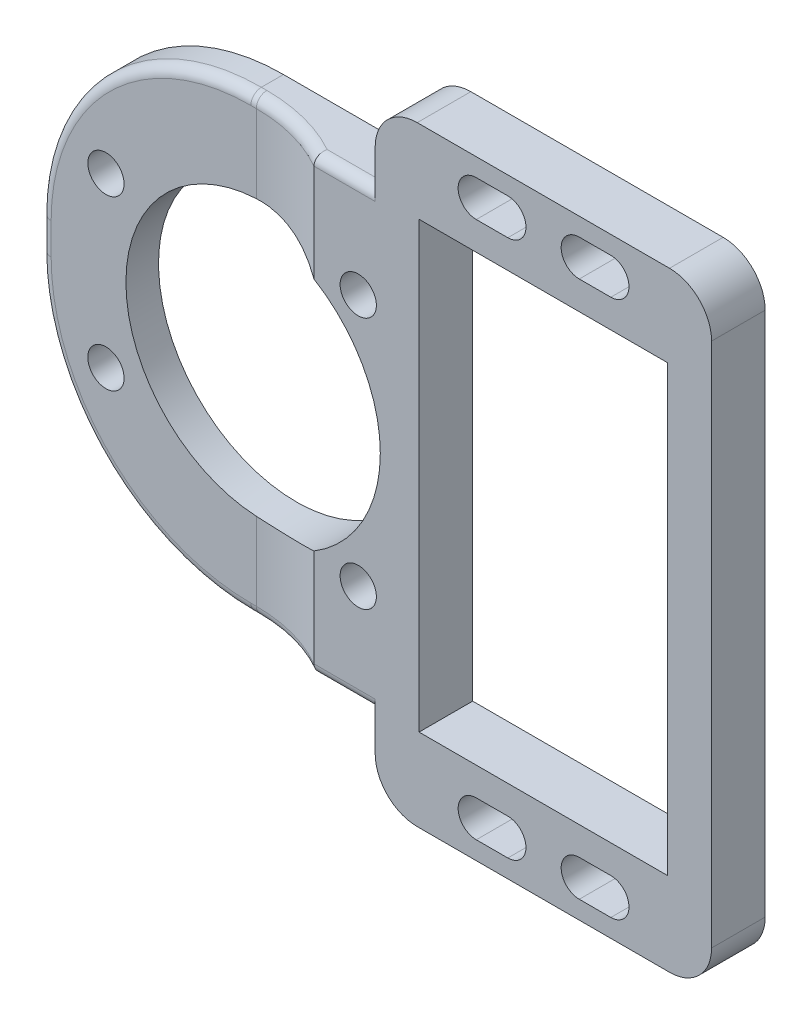
from build123d import *

# Parameters (mm, degrees)
SKETCH1_R           = 1.725
SKETCH1_R_2         = 13.1
SKETCH1_W           = 23.65
SKETCH1_H           = 42.25
BOSS_EXTRUDE1_DEPTH = 5.1
CUT_EXTRUDE1_START  = -2
SKETCH2_R           = 1.725
CUT_EXTRUDE1_DEPTH  = 2
FILLET1_R           = 4
FILLET2_R           = 20
FILLET3_R           = 15
FILLET4_R           = 1


with BuildPart() as part:
    # Sketch1 → Boss-Extrude1 (new body)
    with BuildSketch(Plane.XY):
        Polygon((12.6125, 29), (12.6125, 21.5), (-21.2125, 21.5), (-21.2125, -21.5), (12.6125, -21.5), (12.6125, -29), (44.6125, -29), (44.6125, 29), align=None)
        with Locations((-15, -8)):
            Circle(SKETCH1_R, mode=Mode.SUBTRACT)
        with Locations((-15, 8)):
            Circle(SKETCH1_R, mode=Mode.SUBTRACT)
        with Locations((11, 12)):
            Circle(SKETCH1_R, mode=Mode.SUBTRACT)
        with Locations((11, -12)):
            Circle(SKETCH1_R, mode=Mode.SUBTRACT)
        Circle(SKETCH1_R_2, mode=Mode.SUBTRACT)
        with BuildLine():
            Line((22.229319933, 27.275), (25.229319933, 27.275))
            ThreePointArc((25.229319933, 27.275), (26.954319933, 25.55), (25.229319933, 23.825))
            Line((25.229319933, 23.825), (22.229319933, 23.825))
            ThreePointArc((22.229319933, 23.825), (20.504319933, 25.55), (22.229319933, 27.275))
        make_face(mode=Mode.SUBTRACT)
        with BuildLine():
            Line((32.029319933, 27.275), (35.029319933, 27.275))
            ThreePointArc((35.029319933, 27.275), (36.754319933, 25.55), (35.029319933, 23.825))
            Line((35.029319933, 23.825), (32.029319933, 23.825))
            ThreePointArc((32.029319933, 23.825), (30.304319933, 25.55), (32.029319933, 27.275))
        make_face(mode=Mode.SUBTRACT)
        with BuildLine():
            Line((22.229319933, -23.825), (25.229319933, -23.825))
            ThreePointArc((25.229319933, -23.825), (26.954319933, -25.55), (25.229319933, -27.275))
            Line((25.229319933, -27.275), (22.229319933, -27.275))
            ThreePointArc((22.229319933, -27.275), (20.504319933, -25.55), (22.229319933, -23.825))
        make_face(mode=Mode.SUBTRACT)
        with BuildLine():
            Line((32.029319933, -23.825), (35.029319933, -23.825))
            ThreePointArc((35.029319933, -23.825), (36.754319933, -25.55), (35.029319933, -27.275))
            Line((35.029319933, -27.275), (32.029319933, -27.275))
            ThreePointArc((32.029319933, -27.275), (30.304319933, -25.55), (32.029319933, -23.825))
        make_face(mode=Mode.SUBTRACT)
        with Locations((28.6125, 0)):
            Rectangle(SKETCH1_W, SKETCH1_H, mode=Mode.SUBTRACT)
    extrude(amount=BOSS_EXTRUDE1_DEPTH)

    # Sketch2 → Cut-Extrude1 (cut)
    with BuildSketch(Plane.XY.offset(5.1).offset(CUT_EXTRUDE1_START)):
        with BuildLine():
            Line((6.7875, 11.204456424), (6.7875, 21.5))
            Line((6.7875, 21.5), (-21.2125, 21.5))
            Line((-21.2125, 21.5), (-21.2125, -21.5))
            Line((-21.2125, -21.5), (6.7875, -21.5))
            Line((6.7875, -21.5), (6.7875, -11.204456424))
            ThreePointArc((6.7875, -11.204456424), (-13.1, 0), (6.7875, 11.204456424))
        make_face()
        with Locations((-15, -8)):
            Circle(SKETCH2_R, mode=Mode.SUBTRACT)
        with Locations((-15, 8)):
            Circle(SKETCH2_R, mode=Mode.SUBTRACT)
    extrude(amount=CUT_EXTRUDE1_DEPTH, mode=Mode.SUBTRACT)

    # Fillet1
    fillet1_edges = [part.edges().sort_by_distance(p)[0] for p in [
        (12.6125, 29, 2.55),
        (44.6125, 29, 2.55),
        (44.6125, -29, 2.55),
        (12.6125, -29, 2.55),
    ]]
    fillet(fillet1_edges, radius=FILLET1_R)

    # Fillet2
    fillet2_edges = [part.edges().sort_by_distance(p)[0] for p in [
        (-21.2125, -21.5, 1.55),
        (-21.2125, 21.5, 1.55),
    ]]
    fillet(fillet2_edges, radius=FILLET2_R)

    # Fillet3
    # the kernel refuses this fillet: 15 mm, written as the material it adds along each edge
    with BuildSketch(Plane(origin=(6.7875, -21.5, 3.1), x_dir=(-1, 0, 0), z_dir=(0, 1, 0))) as fillet3_piece_1_section:
        with BuildLine():
            CenterArc((7.483314774, 15), FILLET3_R, 240.073565133, 29.926434867)
            Line((0, 2), (-0.149666295, 1.74))
            ThreePointArc((-0.149666295, 1.74), (-0.3, 1), (-0.3, 0))
            Line((-0.3, 0), (0, -0.3))
            Line((0, -0.3), (7.483314774, -0.3))
            Line((7.483314774, -0.3), (7.483314774, 0))
        make_face()
    fillet3_piece_1 = extrude(amount=29.00383051, mode=Mode.PRIVATE)
    fillet3_piece_1 = fillet3_piece_1 - Plane(origin=(0, 0, 3.507090061), x_dir=(1, 0, 0), z_dir=(0, 0, -1)) * Cylinder(13.1, 88, mode=Mode.PRIVATE)
    add(fillet3_piece_1)
    with BuildSketch(Plane(origin=(6.7875, -7.50383051, 3.1), x_dir=(-1, 0, 0), z_dir=(0, 1, 0))) as fillet3_piece_2_section:
        with BuildLine():
            CenterArc((7.483314774, 15), FILLET3_R, 240.073565133, 29.926434867)
            Line((0, 2), (-0.149666295, 1.74))
            ThreePointArc((-0.149666295, 1.74), (-0.3, 1), (-0.3, 0))
            Line((-0.3, 0), (0, -0.3))
            Line((0, -0.3), (7.483314774, -0.3))
            Line((7.483314774, -0.3), (7.483314774, 0))
        make_face()
    fillet3_piece_2 = extrude(amount=29.00383051, mode=Mode.PRIVATE)
    fillet3_piece_2 = fillet3_piece_2 - Plane(origin=(0, 0, 3.507090028), x_dir=(1, 0, 0), z_dir=(0, 0, -1)) * Cylinder(13.1, 88, mode=Mode.PRIVATE)
    add(fillet3_piece_2)

    # Fillet4
    # the kernel refuses this fillet: 1 mm, written as the material it takes off along each edge
    with BuildSketch(Plane(origin=(4.2875, -21.5, 5.1), x_dir=(0, 1, 0), z_dir=(1, 0, 0)), Plane(origin=(12.6125, 21.5, 5.1), x_dir=(0, -1, 0), z_dir=(-1, 0, 0))) as fillet4_piece_1:
        with BuildLine():
            CenterArc((FILLET4_R, -FILLET4_R), FILLET4_R, 90, 90)
            Line((0, -FILLET4_R), (0, 0))
            Line((0, 0), (FILLET4_R, 0))
        make_face()
    extrude(amount=8.325, mode=Mode.SUBTRACT)
    with BuildSketch(Plane(origin=(-1.2125, -21.5, 3.1), x_dir=(0, 1, 0), z_dir=(1, 0, 0)), Plane(origin=(-0.695814774, 21.5, 3.1), x_dir=(0, -1, 0), z_dir=(-1, 0, 0))) as fillet4_piece_2:
        with BuildLine():
            CenterArc((FILLET4_R, -FILLET4_R), FILLET4_R, 90, 90)
            Line((0, -FILLET4_R), (0, 0))
            Line((0, 0), (FILLET4_R, 0))
        make_face()
    extrude(amount=0.516685226, mode=Mode.SUBTRACT)
    with BuildSketch(Plane(origin=(-21.2125, 1.5, 3.1), x_dir=(1, 0, 0), z_dir=(0, -1, 0))) as fillet4_piece_3:
        with BuildLine():
            CenterArc((FILLET4_R, -FILLET4_R), FILLET4_R, 90, 90)
            Line((0, -FILLET4_R), (0, 0))
            Line((0, 0), (FILLET4_R, 0))
        make_face()
    extrude(amount=3, mode=Mode.SUBTRACT)
    with BuildSketch(Plane(origin=(-1.2125, 1.5, 3.1), x_dir=(0, 1, 0), z_dir=(1, 0, 0))) as fillet4_piece_4:
        with BuildLine():
            CenterArc((20 - FILLET4_R, -FILLET4_R), FILLET4_R, 0, 90)
            Line((20, -FILLET4_R), (20, 0))
            Line((20, 0), (20 - FILLET4_R, 0))
        make_face()
    revolve(axis=Axis((-1.2125, 1.5, 3.1), (0, 0, 1)), revolution_arc=90, mode=Mode.SUBTRACT)
    with BuildSketch(Plane(origin=(-1.2125, -1.5, 3.1), x_dir=(-1, 0, 0), z_dir=(0, 1, 0))) as fillet4_piece_5:
        with BuildLine():
            CenterArc((20 - FILLET4_R, -FILLET4_R), FILLET4_R, 0, 90)
            Line((20, -FILLET4_R), (20, 0))
            Line((20, 0), (20 - FILLET4_R, 0))
        make_face()
    revolve(axis=Axis((-1.2125, -1.5, 3.1), (0, 0, 1)), revolution_arc=90, mode=Mode.SUBTRACT)
    with BuildSketch(Plane(origin=(-0.695814774, -21.5, 18.1), x_dir=(0.6357570418169636, 0, -0.7718892302527245), z_dir=(0.7718892302527245, 0, 0.6357570418169636))) as fillet4_piece_6:
        with BuildLine():
            CenterArc((15 + FILLET4_R, FILLET4_R), FILLET4_R, 180, 90)
            Line((15 + FILLET4_R, 0), (15, 0))
            Line((15, 0), (15, FILLET4_R))
        make_face()
    revolve(axis=Axis((-0.695814774, -21.5, 18.1), (0, 1, 0)), revolution_arc=39.476155484, mode=Mode.SUBTRACT)
    with BuildSketch(Plane(origin=(-0.695814774, 21.5, 18.1), x_dir=(0.6357570418169636, 0, -0.7718892302527245), z_dir=(0.7718892302527245, 0, 0.6357570418169636))) as fillet4_piece_7:
        with BuildLine():
            CenterArc((15 + FILLET4_R, -FILLET4_R), FILLET4_R, 90, 90)
            Line((15 + FILLET4_R, 0), (15, 0))
            Line((15, 0), (15, -FILLET4_R))
        make_face()
    revolve(axis=Axis((-0.695814774, 21.5, 18.1), (0, 1, 0)), revolution_arc=39.476155484, mode=Mode.SUBTRACT)


solid = part.part
